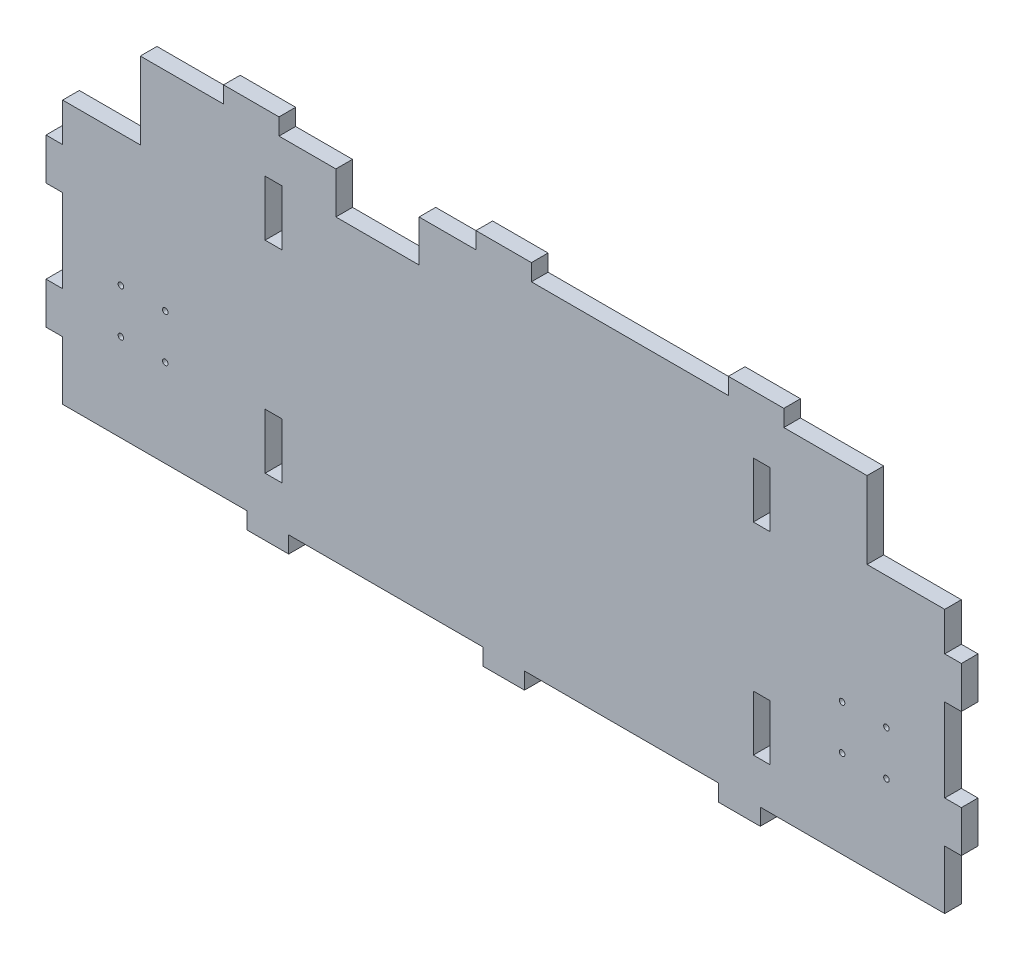
from build123d import *

# Parameters (mm, degrees)
ESQUISSE1_W             = 6
ESQUISSE1_H             = 20
BOSS_EXTRU_1_DEPTH      = 6
ESQUISSE2_W             = 15
ESQUISSE2_H             = 6
ESQUISSE2_W_2           = 6
ESQUISSE2_H_2           = 15
ESQUISSE2_W_3           = 20
BOSS_EXTRU_2_DEPTH      = 6
ESQUISSE3_R             = 1
ENL_V_MAT_EXTRU_1_DEPTH = 6
ESQUISSE4_W             = 30
ESQUISSE4_H             = 15
ENL_V_MAT_EXTRU_2_DEPTH = 6


with BuildPart() as part:
    # Esquisse1 → Boss.-Extru.1 (new body)
    with BuildSketch(Plane.XY):
        Polygon((-159, 35), (-131, 35), (-131, 62.75), (131, 62.75), (131, 35), (159, 35), (159, -60), (-159, -60), align=None)
        with Locations((93, 37.75)):
            Rectangle(ESQUISSE1_W, ESQUISSE1_H, mode=Mode.SUBTRACT)
        with Locations((93, -35.01)):
            Rectangle(ESQUISSE1_W, ESQUISSE1_H, mode=Mode.SUBTRACT)
        with Locations((-83, 37.75)):
            Rectangle(ESQUISSE1_W, ESQUISSE1_H, mode=Mode.SUBTRACT)
        with Locations((-83, -35.01)):
            Rectangle(ESQUISSE1_W, ESQUISSE1_H, mode=Mode.SUBTRACT)
    extrude(amount=BOSS_EXTRU_1_DEPTH)

    # Esquisse2 → Boss.-Extru.2 (add)
    with BuildSketch(Plane.XY.offset(6)):
        with Locations((-85, -63)):
            Rectangle(ESQUISSE2_W, ESQUISSE2_H)
        with Locations((0, -63)):
            Rectangle(ESQUISSE2_W, ESQUISSE2_H)
        with Locations((85, -63)):
            Rectangle(ESQUISSE2_W, ESQUISSE2_H)
        with Locations((-162, 13.59)):
            Rectangle(ESQUISSE2_W_2, ESQUISSE2_H_2)
        with Locations((-162, -31.41)):
            Rectangle(ESQUISSE2_W_2, ESQUISSE2_H_2)
        with Locations((162, -31.41)):
            Rectangle(ESQUISSE2_W_2, ESQUISSE2_H_2)
        with Locations((162, 13.59)):
            Rectangle(ESQUISSE2_W_2, ESQUISSE2_H_2)
        with Locations((91, 65.75)):
            Rectangle(ESQUISSE2_W_3, ESQUISSE2_H)
        with Locations((-91, 65.75)):
            Rectangle(ESQUISSE2_W_3, ESQUISSE2_H)
        with Locations((0, 65.75)):
            Rectangle(ESQUISSE2_W_3, ESQUISSE2_H)
    extrude(amount=-BOSS_EXTRU_2_DEPTH)

    # Esquisse3 → Enlèv. mat.-Extru.1 (cut)
    with BuildSketch(Plane(origin=(0, 0, 0), x_dir=(-1, 0, 0), z_dir=(0, 0, -1))):
        with Locations((138, -28.38)):
            Circle(ESQUISSE3_R)
        with Locations((138, -12.38)):
            Circle(ESQUISSE3_R)
        with Locations((122, -12.38)):
            Circle(ESQUISSE3_R)
        with Locations((122, -28.38)):
            Circle(ESQUISSE3_R)
        with Locations((-122, -28.38)):
            Circle(ESQUISSE3_R)
        with Locations((-122, -12.38)):
            Circle(ESQUISSE3_R)
        with Locations((-138, -12.38)):
            Circle(ESQUISSE3_R)
        with Locations((-138, -28.38)):
            Circle(ESQUISSE3_R)
    extrude(amount=-ENL_V_MAT_EXTRU_1_DEPTH, mode=Mode.SUBTRACT)

    # Esquisse4 → Enlèv. mat.-Extru.2 (cut)
    with BuildSketch(Plane(origin=(0, 0, 0), x_dir=(-1, 0, 0), z_dir=(0, 0, -1))):
        with Locations((45.5, 55.25)):
            Rectangle(ESQUISSE4_W, ESQUISSE4_H)
    extrude(amount=-ENL_V_MAT_EXTRU_2_DEPTH, mode=Mode.SUBTRACT)


solid = part.part
